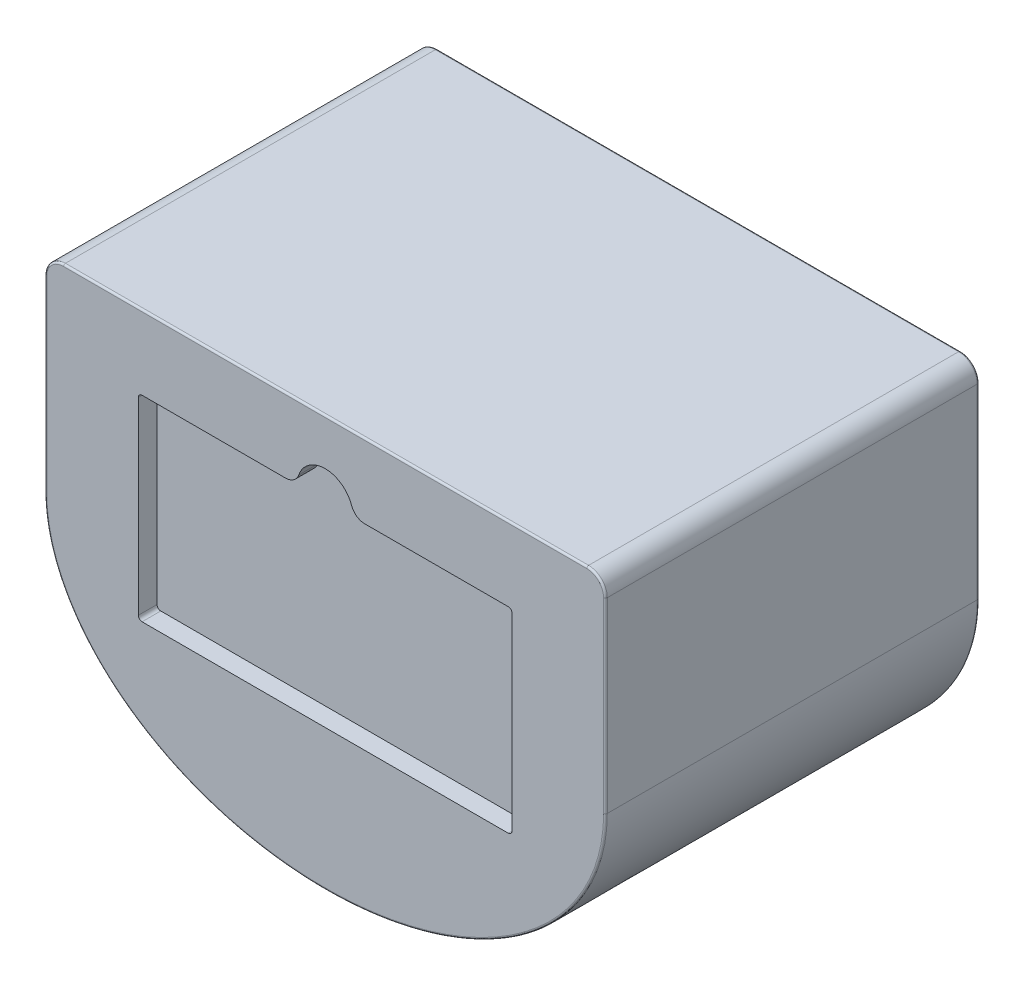
from build123d import *

# Parameters (mm, degrees)
SKETCH2_RX              = 150
SKETCH2_RY              = 110
BOSS_EXTRUDE1_DEPTH     = 200
BOSS_EXTRUDE2_OUTLINE_W = 300
BOSS_EXTRUDE2_OUTLINE_H = 200
BOSS_EXTRUDE2_DEPTH     = 110
FILLET1_R               = 10
CUT_EXTRUDE1_DEPTH      = 75
SKETCH5_R               = 45
CUT_EXTRUDE2_DEPTH      = 70
CUT_EXTRUDE4_DEPTH      = 10
FILLET2_R               = 1


# Read off the part's stored shape, not the designer's step: Boss-Extrude2
with BuildPart() as part:
    # Sketch2 → Boss-Extrude1 (new body)
    with BuildSketch(Plane.XY):
        with Locations((0, 0)):
            Ellipse(SKETCH2_RX, SKETCH2_RY)
    extrude(amount=BOSS_EXTRUDE1_DEPTH)

    # Boss-Extrude2 outline → Boss-Extrude2 (add)
    with BuildSketch(Plane(origin=(0, 0, 0), x_dir=(1, 0, 0), z_dir=(0, 1, 0))):
        with Locations((0, -100)):
            Rectangle(BOSS_EXTRUDE2_OUTLINE_W, BOSS_EXTRUDE2_OUTLINE_H)
    extrude(amount=BOSS_EXTRUDE2_DEPTH)

    # Fillet1
    fillet1_edges = [part.edges().sort_by_distance(p)[0] for p in [
        (150, 110, 100),
        (-150, 110, 100),
    ]]
    fillet(fillet1_edges, radius=FILLET1_R)

    # Sketch3 → Cut-Extrude1 (cut, symmetric)
    with BuildSketch(Plane.XY.offset(100)):
        with BuildLine():
            Line((-135, 0), (-135, 80))
            ThreePointArc((-135, 80), (-132.071067812, 87.071067812), (-125, 90))
            Line((-125, 90), (125, 90))
            ThreePointArc((125, 90), (132.071067812, 87.071067812), (135, 80))
            Line((135, 80), (135, 0))
            add(Edge.make_bspline(
                [(-135, 0), (-135, -90), (0, -90), (135, -90), (135, 0)],
                knots=[3.141592654, 3.141592654, 3.141592654, 4.71238898, 4.71238898, 6.283185307, 6.283185307, 6.283185307], degree=2, weights=[1, 0.707106781, 1, 0.707106781, 1]))
        make_face()
    extrude(amount=CUT_EXTRUDE1_DEPTH, both=True, mode=Mode.SUBTRACT)

    # Sketch5 → Cut-Extrude2 (cut)
    with BuildSketch(Plane(origin=(0, -110, 0), x_dir=(1, 0, 0), z_dir=(0, 1, 0))):
        with Locations(Location((0, -100, 0), (0, 0, 90))):
            Circle(SKETCH5_R)
    extrude(amount=CUT_EXTRUDE2_DEPTH, mode=Mode.SUBTRACT)

    # Sketch7 → Cut-Extrude4 (cut)
    with BuildSketch(Plane.XY.offset(200)):
        with BuildLine():
            Line((21.213203436, 70.33362651), (98, 70.33362651))
            ThreePointArc((98, 70.33362651), (99.414213562, 69.747840073), (100, 68.33362651))
            Line((100, 68.33362651), (100, -32.66637349))
            ThreePointArc((100, -32.66637349), (99.414213562, -34.080587052), (98, -34.66637349))
            Line((98, -34.66637349), (-98, -34.66637349))
            ThreePointArc((-98, -34.66637349), (-99.414213562, -34.080587052), (-100, -32.66637349))
            Line((-100, -32.66637349), (-100, 68.33362651))
            ThreePointArc((-100, 68.33362651), (-99.414213562, 69.747840073), (-98, 70.33362651))
            Line((-98, 70.33362651), (-21.213203436, 70.33362651))
            ThreePointArc((-21.213203436, 70.33362651), (-16.883076417, 71.709902153), (-14.142135624, 75.33362651))
            ThreePointArc((-14.142135624, 75.33362651), (0, 85.33362651), (14.142135624, 75.33362651))
            ThreePointArc((14.142135624, 75.33362651), (16.883076417, 71.709902153), (21.213203436, 70.33362651))
        make_face()
    extrude(amount=-CUT_EXTRUDE4_DEPTH, mode=Mode.SUBTRACT)

    # Fillet2
    fillet2_edges = [part.edges().sort_by_distance(p)[0] for p in [
        (150, 50, 0),
        (150, 50, 200),
        (0, 110, 0),
        (0, 110, 200),
        (-147.071067812, 107.071067812, 0),
        (147.071067812, 107.071067812, 0),
        (-147.071067812, 107.071067812, 200),
        (147.071067812, 107.071067812, 200),
        (-150, 50, 200),
        (-150, 50, 0),
    ]]
    fillet(fillet2_edges, radius=FILLET2_R)


solid = part.part
